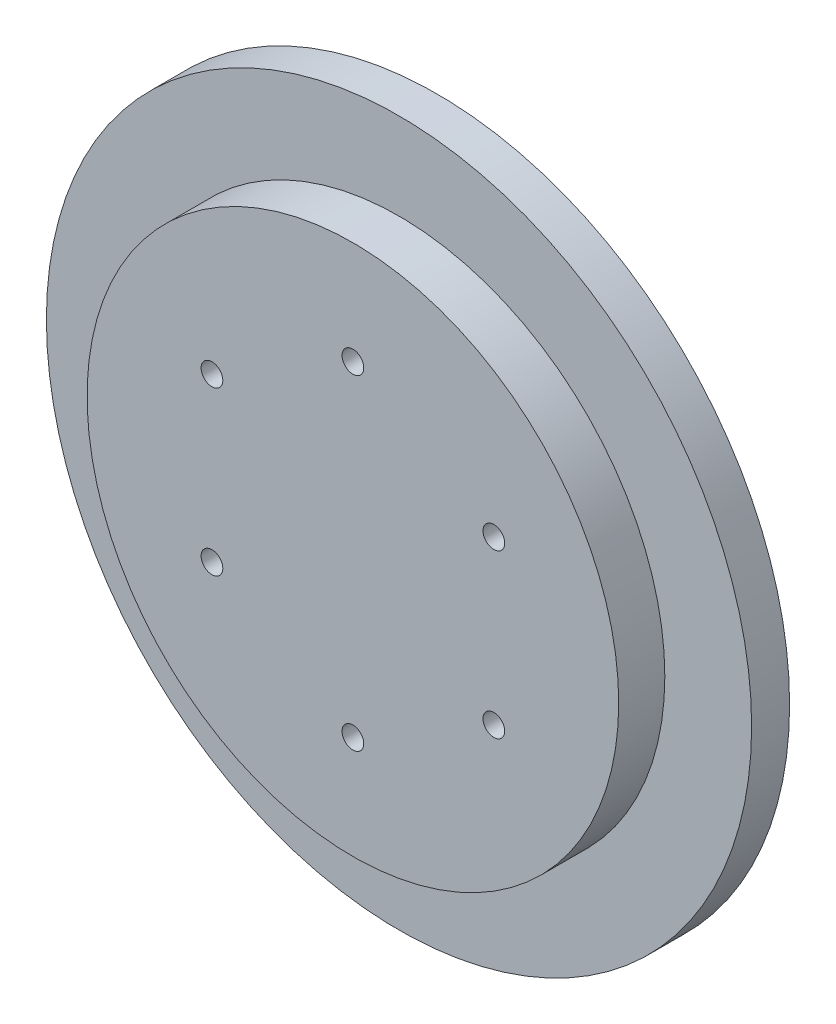
from build123d import *

# Parameters (mm, degrees)
SKETCH1_R           = 49
BOSS_EXTRUDE1_DEPTH = 8.5
SKETCH3_R           = 65
BOSS_EXTRUDE2_DEPTH = 7
SKETCH4_R           = 11
CUT_EXTRUDE1_DEPTH  = 7
SKETCH5_R           = 7.5
CUT_EXTRUDE2_DEPTH  = 0.5
SKETCH6_R           = 2
CUT_EXTRUDE3_DEPTH  = 8
CIRPATTERN1_COUNT   = 6


with BuildPart() as part:
    # Sketch1 → Boss-Extrude1 (new body)
    with BuildSketch(Plane.XY):
        Circle(SKETCH1_R)
    extrude(amount=BOSS_EXTRUDE1_DEPTH)

    # Sketch3 → Boss-Extrude2 (add)
    with BuildSketch(Plane(origin=(0, 0, 0), x_dir=(-1, 0, 0), z_dir=(0, 0, -1))):
        Circle(SKETCH3_R)
    extrude(amount=BOSS_EXTRUDE2_DEPTH)

    # Sketch4 → Cut-Extrude1 (cut)
    with BuildSketch(Plane(origin=(0, 0, -7), x_dir=(-1, 0, 0), z_dir=(0, 0, -1))):
        Circle(SKETCH4_R)
    extrude(amount=-CUT_EXTRUDE1_DEPTH, mode=Mode.SUBTRACT)

    # Sketch5 → Cut-Extrude2 (cut)
    with BuildSketch(Plane(origin=(0, 0, 0), x_dir=(-1, 0, 0), z_dir=(0, 0, -1))):
        Circle(SKETCH5_R)
    extrude(amount=-CUT_EXTRUDE2_DEPTH, mode=Mode.SUBTRACT)

    # Sketch6 → Cut-Extrude3 (cut)
    with BuildSketch(Plane.XY.offset(8.5)):
        with Locations((0, 30)):
            Circle(SKETCH6_R)
    cut_extrude3 = extrude(amount=-CUT_EXTRUDE3_DEPTH, mode=Mode.SUBTRACT)

    # CirPattern1: Cut-Extrude3 ×6 about axis
    cirpattern1_axis = Axis((0, 0, 8.5), (0, 0, 1))
    for i in range(1, CIRPATTERN1_COUNT):
        add(cut_extrude3.rotate(cirpattern1_axis, i * 360 / CIRPATTERN1_COUNT), mode=Mode.SUBTRACT)


solid = part.part
